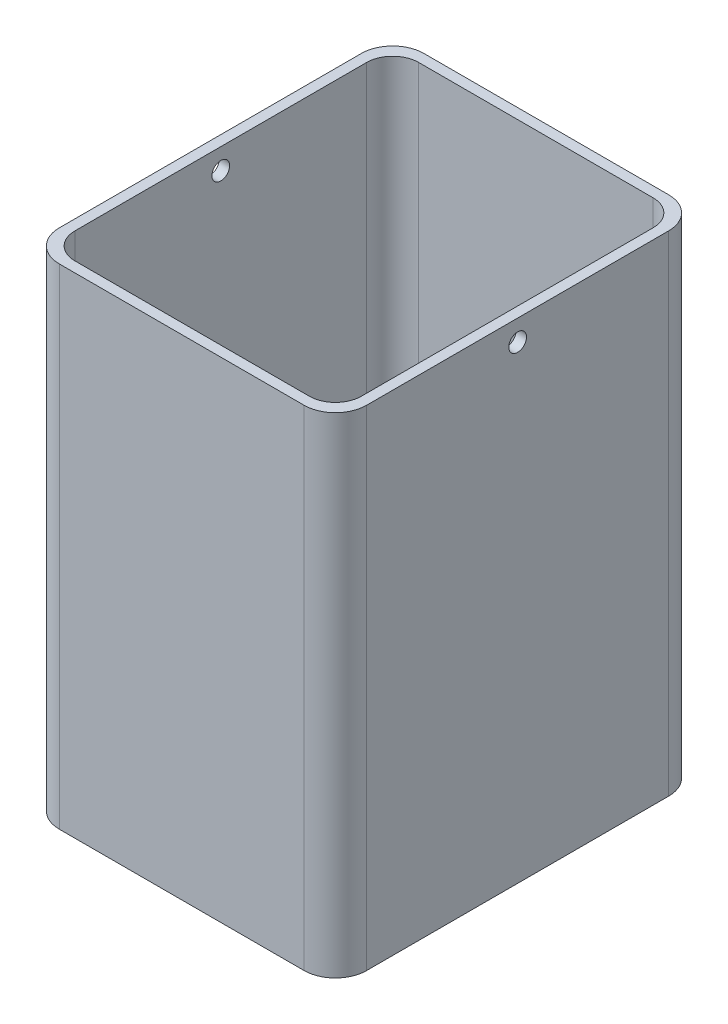
from build123d import *

# Parameters (mm, degrees)
BOSS_EXTRUDE1_DEPTH = 4
BOSS_EXTRUDE2_DEPTH = 90
SKETCH4_R           = 1.7
CUT_EXTRUDE1_DEPTH  = 93


# Read off the part's stored shape, not the designer's step: Surface-Imported1
with BuildPart() as part:
    # Sketch2 → Boss-Extrude1 (new body)
    with BuildSketch(Plane(origin=(0, 0, 0), x_dir=(1, 0, 0), z_dir=(0, 1, 0))):
        with BuildLine():
            Line((6.000000983, 0), (52.999999374, 0))
            ThreePointArc((52.999999374, 0), (57.242640757, -1.757359601), (59.000000358, -6.000000983))
            Line((59.000000358, -6.000000983), (59.000000358, -63.999995589))
            ThreePointArc((59.000000358, -63.999995589), (57.242641528, -68.242638834), (52.999999374, -70.000000298))
            Line((52.999999374, -70.000000298), (6.000000983, -70.000000298))
            ThreePointArc((6.000000983, -70.000000298), (1.75735699, -68.242640674), (0, -63.999995589))
            Line((0, -63.999995589), (0, -6.000000983))
            ThreePointArc((0, -6.000000983), (1.757359601, -1.757359601), (6.000000983, 0))
        make_face()
    extrude(amount=BOSS_EXTRUDE1_DEPTH)

    # Sketch3 → Boss-Extrude2 (add)
    with BuildSketch(Plane(origin=(0, 4, 0), x_dir=(1, 0, 0), z_dir=(0, 1, 0))):
        with BuildLine():
            Line((59.000000358, -6), (59.000000358, -64.000000298))
            ThreePointArc((59.000000358, -64.000000298), (57.242641045, -68.242640985), (53.000000358, -70.000000298))
            Line((53.000000358, -70.000000298), (6, -70.000000298))
            ThreePointArc((6, -70.000000298), (1.757359313, -68.242640985), (0, -64.000000298))
            Line((0, -64.000000298), (0, -6))
            ThreePointArc((0, -6), (1.757359313, -1.757359313), (6, 0))
            Line((6, 0), (53.000000358, 0))
            ThreePointArc((53.000000358, 0), (57.242641045, -1.757359313), (59.000000358, -6))
        make_face()
        with BuildLine():
            Line((2, -7), (2, -63.000000298))
            ThreePointArc((2, -63.000000298), (3.464466094, -66.535534204), (7, -68.000000298))
            Line((7, -68.000000298), (52.000000358, -68.000000298))
            ThreePointArc((52.000000358, -68.000000298), (55.535534264, -66.535534204), (57.000000358, -63.000000298))
            Line((57.000000358, -63.000000298), (57.000000358, -7))
            ThreePointArc((57.000000358, -7), (55.535534264, -3.464466094), (52.000000358, -2))
            Line((52.000000358, -2), (7, -2))
            ThreePointArc((7, -2), (3.464466094, -3.464466094), (2, -7))
        make_face(mode=Mode.SUBTRACT)
    extrude(amount=BOSS_EXTRUDE2_DEPTH)

    # Sketch4 → Cut-Extrude1 (cut)
    with BuildSketch(Plane(origin=(59.000000358, 0, 0), x_dir=(0, 0, -1), z_dir=(1, 0, 0))):
        with Locations((-35.000000098, 90)):
            Circle(SKETCH4_R)
    extrude(amount=-CUT_EXTRUDE1_DEPTH, mode=Mode.SUBTRACT)


solid = part.part
